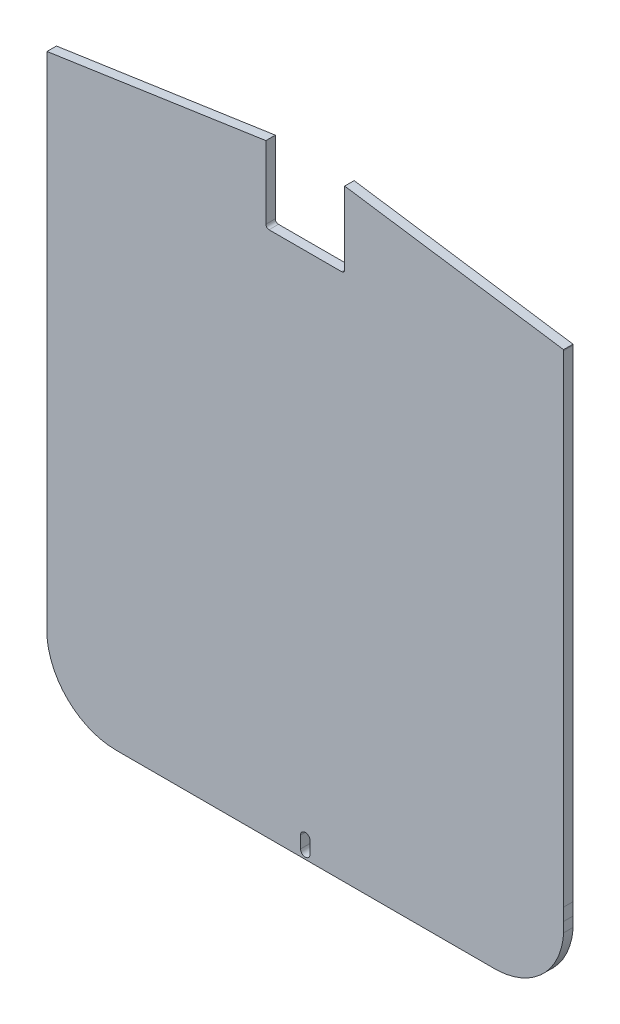
from build123d import *

# Parameters (mm, degrees)
SKETCH1_W               = 166
SKETCH1_H               = 205
BOSS_EXTRUDE1_DEPTH     = 3
CUT_EXTRUDE1_DEPTH      = 157.378547122
CUT_EXTRUDE1_DEPTH_BACK = 157.378547122
SKETCH2_OUTSIDE_W       = 220.76
SKETCH2_OUTSIDE_H       = 259.76


with BuildPart() as part:
    # Sketch1 → Boss-Extrude1 (new body)
    with BuildSketch(Plane.XY):
        with Locations((0, 30)):
            Rectangle(SKETCH1_W, SKETCH1_H)
        with BuildLine():
            Line((1.5, -63.574779746), (1.5, -67.368002282))
            ThreePointArc((1.5, -67.368002282), (0, -68.868002282), (-1.5, -67.368002282))
            Line((-1.5, -67.368002282), (-1.5, -63.574779746))
            ThreePointArc((-1.5, -63.574779746), (0, -62.074779746), (1.5, -63.574779746))
        make_face(mode=Mode.SUBTRACT)
    extrude(amount=BOSS_EXTRUDE1_DEPTH)

    # Sketch2 outside → Cut-Extrude1 (cut, two sides: drawn at the far end of the back side and taken through both)
    with BuildSketch(Plane.XY.offset(3).offset(-CUT_EXTRUDE1_DEPTH_BACK)):
        with Locations((0, 30)):
            Rectangle(SKETCH2_OUTSIDE_W, SKETCH2_OUTSIDE_H)
        with BuildLine():
            Line((82.000466719, 111.300523457), (82, -41.585253462))
            Line((82, -41.585253462), (82, -45.523620456))
            add(Edge.make_bspline(
                [(82, -45.523620456), (81.995391752, -46.6328702), (81.985428438, -47.66056193), (81.968014469, -48.685892198)],
                knots=[0, 0, 0, 0, 1, 1, 1, 1], degree=3))
            add(Edge.make_bspline(
                [(81.968014469, -48.685892198), (81.956254218, -48.903744514), (81.940334729, -49.140646107), (81.894530826, -49.667839381), (81.864952444, -49.954185999), (81.785747164, -50.57902498), (81.735135616, -50.922594607), (81.611165362, -51.633739927), (81.537648765, -52.003653392), (81.363812855, -52.766944895), (81.16923473, -53.527223987), (80.933031745, -54.27971943), (80.54722693, -55.401716257), (80.255736382, -56.119392861), (79.768420479, -57.16212964), (79.597235241, -57.504563852), (79.241921033, -58.17199147), (79.057417229, -58.497866463), (78.483696666, -59.454322663), (78.074304035, -60.063892247), (77.202571749, -61.233294578), (76.739269477, -61.79407815), (75.763608753, -62.863347678), (75.257054515, -63.365693493), (73.684905047, -64.783377674), (72.566977476, -65.610075792), (70.796085835, -66.681253157), (70.190075994, -67.00994613), (69.258552836, -67.459912602), (68.944107756, -67.602735472), (68.314727002, -67.871115627), (67.998963398, -67.997092108), (66.415651715, -68.58711973), (65.13459187, -68.932159011), (62.566045739, -69.388738722), (61.27846566, -69.5), (60, -69.5)],
                knots=[0, 0, 0, 0, 0.03125, 0.03125, 0.0625, 0.0625, 0.09375, 0.09375, 0.125, 0.125, 0.15625, 0.1875, 0.1875, 0.25, 0.25, 0.28125, 0.28125, 0.3125, 0.3125, 0.375, 0.375, 0.4375, 0.4375, 0.5, 0.5, 0.625, 0.625, 0.6875, 0.6875, 0.71875, 0.71875, 0.75, 0.75, 0.875, 0.875, 1, 1, 1, 1], degree=3))
            Line((60, -69.5), (-60, -69.5))
            add(Edge.make_bspline(
                [(-60, -69.5), (-61.275873532, -69.5), (-62.569034792, -69.389261286), (-64.516689051, -69.041458745), (-65.169487684, -68.894524644), (-66.462373638, -68.540128674), (-67.101939794, -68.333083287), (-68.996215588, -67.621822419), (-70.226563634, -67.028127667), (-72.008183846, -65.946845644), (-72.591596014, -65.553853707), (-73.713761022, -64.716930112), (-74.25531688, -64.271447947), (-75.819842901, -62.853002083), (-76.783898065, -61.798689748), (-78.096222736, -60.03254417), (-78.504891764, -59.421316402), (-79.264925442, -58.149481286), (-79.616298925, -57.489083268), (-80.260596904, -56.107507255), (-80.554399352, -55.382130016), (-80.935163251, -54.272869867), (-81.05272394, -53.898353001), (-81.268892748, -53.138289429), (-81.367294492, -52.752436853), (-81.495770125, -52.187132217), (-81.535652976, -52.000148441), (-81.609753746, -51.629676514), (-81.644133309, -51.445155154), (-81.73709855, -50.910215557), (-81.786214188, -50.575781851), (-81.84565127, -50.10622548), (-81.863121326, -49.954540981), (-81.893453697, -49.667378774), (-81.906434112, -49.531058427), (-81.940285927, -49.140752528), (-81.956149571, -48.905289872), (-81.967899422, -48.688021453)],
                knots=[0, 0, 0, 0, 0.125, 0.125, 0.1875, 0.1875, 0.25, 0.25, 0.375, 0.375, 0.4375, 0.4375, 0.5, 0.5, 0.625, 0.625, 0.6875, 0.6875, 0.75, 0.75, 0.8125, 0.8125, 0.84375, 0.84375, 0.875, 0.875, 0.890625, 0.890625, 0.90625, 0.90625, 0.9375, 0.9375, 0.953125, 0.953125, 0.96875, 0.96875, 1, 1, 1, 1], degree=3))
            add(Edge.make_bspline(
                [(-81.967899422, -48.688021453), (-81.985402383, -47.663525219), (-81.995386883, -46.638372285), (-82, -45.528502663)],
                knots=[0, 0, 0, 0, 1, 1, 1, 1], degree=3))
            Line((-82, -45.528502663), (-82, -41.585253462))
            Line((-82, -41.585253462), (-82, 111.300523457))
            add(Edge.make_bspline(
                [(-82, 111.300523457), (-81.999820313, 111.307021597), (-81.999591832, 111.310384025), (-81.999234349, 111.315916264), (-81.999066582, 111.318078118), (-81.998578736, 111.323950441), (-81.99827302, 111.32700048), (-81.997371699, 111.335394251), (-81.996795235, 111.339840792), (-81.995088295, 111.352105571), (-81.993980837, 111.358706936), (-81.990666319, 111.377090092), (-81.988473128, 111.387218286), (-81.981833097, 111.415699064), (-81.977330825, 111.431854362), (-81.963434208, 111.478006498), (-81.953661233, 111.505266396), (-81.943306082, 111.53180274)],
                knots=[0, 0, 0, 0, 0.0078125, 0.0078125, 0.015625, 0.015625, 0.03125, 0.03125, 0.0625, 0.0625, 0.125, 0.125, 0.25, 0.25, 0.5, 0.5, 1, 1, 1, 1], degree=3))
            Line((-81.943306082, 111.53180274), (-12.5, 121.76433694))
            Line((-12.5, 121.76433694), (-12.5, 98.76433694))
            ThreePointArc((-12.5, 98.76433694), (-12.207106781, 98.057230158), (-11.5, 97.76433694))
            Line((-11.5, 97.76433694), (11.5, 97.76433694))
            ThreePointArc((11.5, 97.76433694), (12.207106781, 98.057230158), (12.5, 98.76433694))
            Line((12.5, 98.76433694), (12.5, 121.76433694))
            Line((12.5, 121.76433694), (81.946773799, 111.553116227))
            add(Edge.make_bspline(
                [(81.946773799, 111.553116227), (81.956955302, 111.524264308), (81.966529409, 111.494590376), (81.979981569, 111.444243229), (81.984314095, 111.426604408), (81.990587103, 111.395461014), (81.992641155, 111.384379725), (81.995663165, 111.364247071), (81.996660714, 111.357015029), (81.998141249, 111.343565421), (81.998632924, 111.338688003), (81.999361586, 111.329476712), (81.999603142, 111.326129164), (81.999960753, 111.319675104), (82.000079583, 111.317301708), (82.000306897, 111.311225888), (82.000454699, 111.307462804), (82.000466719, 111.300523457)],
                knots=[0, 0, 0, 0, 0.5, 0.5, 0.75, 0.75, 0.875, 0.875, 0.9375, 0.9375, 0.96875, 0.96875, 0.984375, 0.984375, 0.9921875, 0.9921875, 1, 1, 1, 1], degree=3))
        make_face(mode=Mode.SUBTRACT)
    extrude(amount=CUT_EXTRUDE1_DEPTH + CUT_EXTRUDE1_DEPTH_BACK, mode=Mode.SUBTRACT)


solid = part.part
